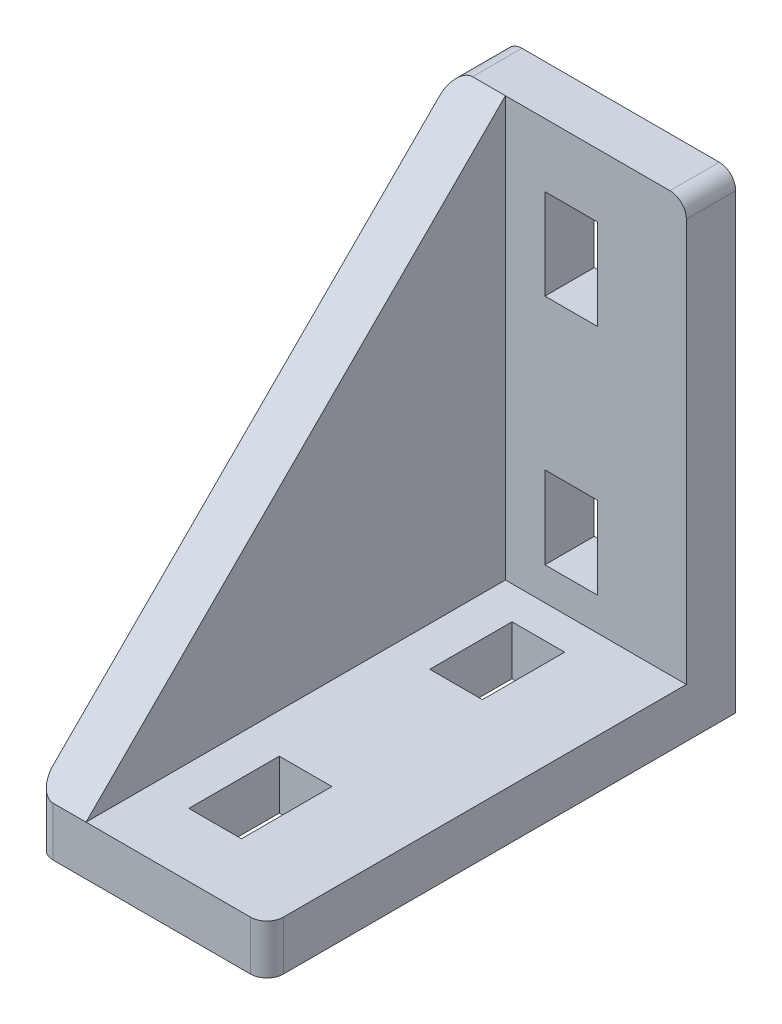
from build123d import *

# Parameters (mm, degrees)
SALIENTE_EXTRUIR1_DEPTH = 28
VACIADO2_START          = 6
VACIADO2_OUTLINE_W      = 22
VACIADO2_OUTLINE_H      = 53
VACIADO2_DEPTH          = 51
CORTAR_EXTRUIR1_REACH   = 83.449
CROQUIS2_W              = 6.4
CROQUIS2_H              = 11
CROQUIS2_H_2            = 10
CORTAR_EXTRUIR2_REACH   = 83.449
CROQUIS5_W              = 6.4
CROQUIS5_H              = 10
CROQUIS5_H_2            = 11
REDONDEO2_R             = 2


# Read off the part's stored shape, not the designer's step: Vaciado2
with BuildPart() as part:
    # Croquis1 → Saliente-Extruir1 (new body)
    with BuildSketch(Plane(origin=(0, 0, 0), x_dir=(0, 0, -1), z_dir=(1, 0, 0))):
        Polygon((0, 0), (57, 0), (57, 57), (51, 57), (0, 6), align=None)
    extrude(amount=SALIENTE_EXTRUIR1_DEPTH)

    # Vaciado2 outline → Vaciado2 (cut)
    with BuildSketch(Plane(origin=(0, 0, 0), x_dir=(1, 0, 0), z_dir=(0, 1, 0)).offset(VACIADO2_START)):
        with Locations((17, 24.5)):
            Rectangle(VACIADO2_OUTLINE_W, VACIADO2_OUTLINE_H)
    extrude(amount=VACIADO2_DEPTH, mode=Mode.SUBTRACT)

    # Croquis2 → Cortar-Extruir1 (cut, up to next)
    with BuildSketch(Plane.XY.offset(-51), mode=Mode.PRIVATE) as cortar_extruir1_sk1:
        with Locations((14, 43.8)):
            Rectangle(CROQUIS2_W, CROQUIS2_H)
    cortar_extruir1_tool1 = extrude(cortar_extruir1_sk1.sketch, amount=-CORTAR_EXTRUIR1_REACH, mode=Mode.PRIVATE) & part.part
    # Croquis2 → Cortar-Extruir1 (cut, up to next)
    with BuildSketch(Plane.XY.offset(-51), mode=Mode.PRIVATE) as cortar_extruir1_sk2:
        with Locations((14, 15)):
            Rectangle(CROQUIS2_W, CROQUIS2_H_2)
    cortar_extruir1_tool2 = extrude(cortar_extruir1_sk2.sketch, amount=-CORTAR_EXTRUIR1_REACH, mode=Mode.PRIVATE) & part.part
    add(cortar_extruir1_tool1.solids().sort_by_distance((14, 43.8, -51))[0], mode=Mode.SUBTRACT)
    add(cortar_extruir1_tool2.solids().sort_by_distance((14, 15, -51))[0], mode=Mode.SUBTRACT)

    # Croquis5 → Cortar-Extruir2 (cut, up to next)
    with BuildSketch(Plane(origin=(0, 6, 0), x_dir=(1, 0, 0), z_dir=(0, 1, 0)), mode=Mode.PRIVATE) as cortar_extruir2_sk1:
        with Locations((14, 42)):
            Rectangle(CROQUIS5_W, CROQUIS5_H)
    cortar_extruir2_tool1 = extrude(cortar_extruir2_sk1.sketch, amount=-CORTAR_EXTRUIR2_REACH, mode=Mode.PRIVATE) & part.part
    # Croquis5 → Cortar-Extruir2 (cut, up to next)
    with BuildSketch(Plane(origin=(0, 6, 0), x_dir=(1, 0, 0), z_dir=(0, 1, 0)), mode=Mode.PRIVATE) as cortar_extruir2_sk2:
        with Locations((14, 13.2)):
            Rectangle(CROQUIS5_W, CROQUIS5_H_2)
    cortar_extruir2_tool2 = extrude(cortar_extruir2_sk2.sketch, amount=-CORTAR_EXTRUIR2_REACH, mode=Mode.PRIVATE) & part.part
    add(cortar_extruir2_tool1.solids().sort_by_distance((14, 6, -42))[0], mode=Mode.SUBTRACT)
    add(cortar_extruir2_tool2.solids().sort_by_distance((14, 6, -13.2))[0], mode=Mode.SUBTRACT)

    # Redondeo2
    redondeo2_edges = [part.edges().sort_by_distance(p)[0] for p in [
        (28, 3, 0),
        (28, 57, -54),
        (0, 3, 0),
        (0, 57, -54),
    ]]
    fillet(redondeo2_edges, radius=REDONDEO2_R)


solid = part.part
